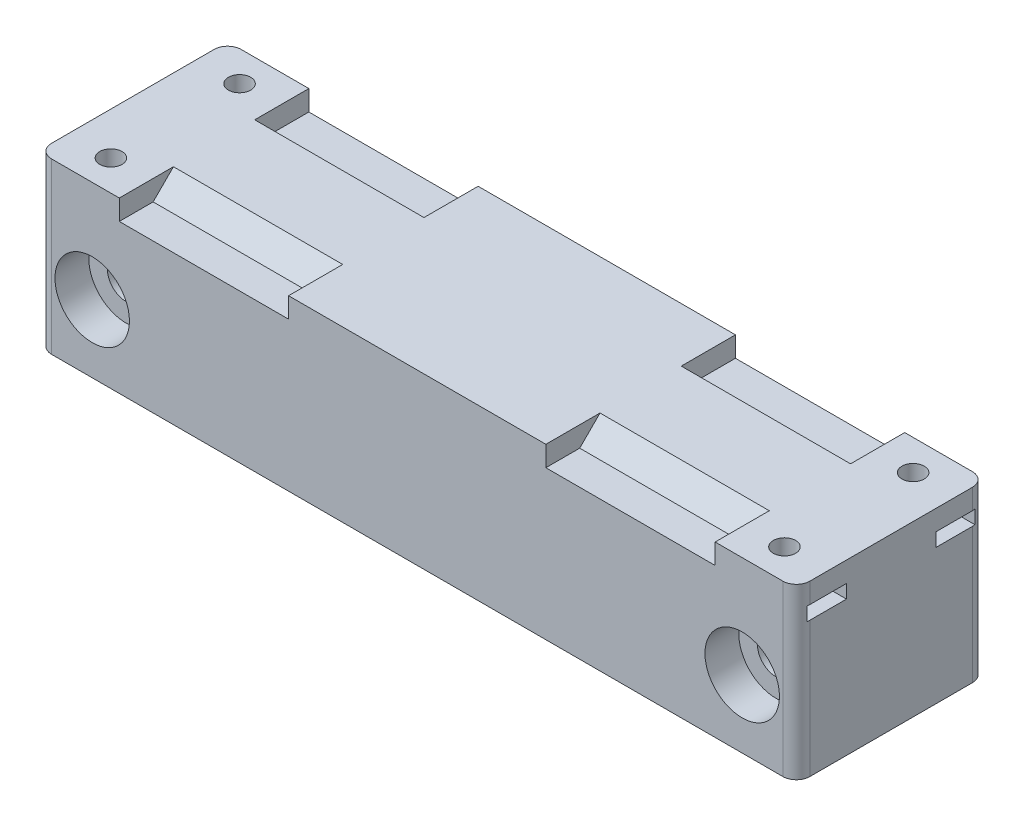
from build123d import *

# Parameters (mm, degrees)
SKETCH1_W                               = 56
SKETCH1_H                               = 25
BOSS_EXTRUDE1_DEPTH                     = 14
CBORE_FOR_M5_HEX_HEAD_BOLT1_D           = 5.5
CBORE_FOR_M5_HEX_HEAD_BOLT1_CBORE_D     = 11
CBORE_FOR_M5_HEX_HEAD_BOLT1_CBORE_DEPTH = 5
SKETCH9_W                               = 25
SKETCH9_H                               = 8
CUT_EXTRUDE2_DEPTH                      = 3
SKETCH8_W                               = 5.8
SKETCH8_H                               = 2
CUT_EXTRUDE1_DEPTH                      = 10
F_3_0MM_DOWEL_HOLE1_D                   = 3.3
F_3_0MM_DOWEL_HOLE1_DEPTH               = 8
F_3_0MM_DOWEL_HOLE1_TIP                 = 0.991420021
FILLET1_R                               = 2
CHAMFER2_SIZE                           = 3


# Some blends are built 0.0001 mm under size
with BuildPart() as part:
    # Sketch1 → Boss-Extrude1 (new, symmetric)
    with BuildSketch(Plane.XY):
        with Locations((-28, 12.5)):
            Rectangle(SKETCH1_W, SKETCH1_H)
    extrude(amount=BOSS_EXTRUDE1_DEPTH, both=True)

    # CBORE for M5 Hex Head Bolt1 (through all)
    with Locations(Plane.XY.offset(14)):
        with Locations((-48, 10)):
            CounterBoreHole(CBORE_FOR_M5_HEX_HEAD_BOLT1_D / 2, CBORE_FOR_M5_HEX_HEAD_BOLT1_CBORE_D / 2, CBORE_FOR_M5_HEX_HEAD_BOLT1_CBORE_DEPTH)

    # Sketch9 → Cut-Extrude2 (cut)
    with BuildSketch(Plane(origin=(0, 25, 0), x_dir=(1, 0, 0), z_dir=(0, 1, 0))):
        with Locations((-31.5, 10)):
            Rectangle(SKETCH9_W, SKETCH9_H)
        with Locations((-31.5, -10)):
            Rectangle(SKETCH9_W, SKETCH9_H)
    extrude(amount=-CUT_EXTRUDE2_DEPTH, mode=Mode.SUBTRACT)

    # Sketch8 → Cut-Extrude1 (cut)
    with BuildSketch(Plane.ZY.offset(56)):
        with Locations((-9.5, 21)):
            Rectangle(SKETCH8_W, SKETCH8_H)
        with Locations((9.5, 21)):
            Rectangle(SKETCH8_W, SKETCH8_H)
    extrude(amount=-CUT_EXTRUDE1_DEPTH, mode=Mode.SUBTRACT)

    # Mirror1: part across plane


with BuildPart() as part_1:
    add(part.part)
    add(part.part.mirror(Plane(origin=(0, 25, 14), x_dir=(0, 0, 1), z_dir=(-1, 0, 0))))

    # Ø3.0mm Dowel Hole1
    with Locations(Plane(origin=(0, 25, 0), x_dir=(1, 0, 0), z_dir=(0, 1, 0))):
        with Locations((49.74, 9.5), (-49.74, -9.5), (-49.74, 9.5), (49.74, -9.5)):
            Hole(F_3_0MM_DOWEL_HOLE1_D / 2, depth=F_3_0MM_DOWEL_HOLE1_DEPTH)
            with Locations((0, 0, -(F_3_0MM_DOWEL_HOLE1_DEPTH + F_3_0MM_DOWEL_HOLE1_TIP / 2))):  # 118° drill point
                Cone(0, F_3_0MM_DOWEL_HOLE1_D / 2, F_3_0MM_DOWEL_HOLE1_TIP, mode=Mode.SUBTRACT)

    # Fillet1
    # the kernel refuses this fillet: 2 mm, written as the material it takes off along each edge
    with BuildSketch(Plane(origin=(-56, 30, -14), x_dir=(0, 0, 1), z_dir=(0, -1, 0)), Plane(origin=(56, 30, -14), x_dir=(-1, 0, 0), z_dir=(0, -1, 0))) as fillet1_piece_1:
        with BuildLine():
            CenterArc((FILLET1_R, -FILLET1_R), FILLET1_R, 90, 90)
            Line((0, -FILLET1_R), (0, 0))
            Line((0, 0), (FILLET1_R, 0))
        make_face()
    extrude(amount=35, mode=Mode.SUBTRACT)
    with BuildSketch(Plane(origin=(-56, 30, 14), x_dir=(0, 0, -1), z_dir=(0, -1, 0)), Plane(origin=(56, 30, 14), x_dir=(-1, 0, 0), z_dir=(0, -1, 0))) as fillet1_piece_2:
        with BuildLine():
            CenterArc((FILLET1_R, FILLET1_R), FILLET1_R, 180, 90)
            Line((0, FILLET1_R), (0, 0))
            Line((0, 0), (FILLET1_R, 0))
        make_face()
    extrude(amount=35, mode=Mode.SUBTRACT)

    # Chamfer2
    chamfer2_edges = [part_1.edges().sort_by_distance(p)[0] for p in [
        (-31.5, 22, 6),
        (31.5, 22, 6),
        (-31.5, 22, -6),
        (31.5, 22, -6),
    ]]
    chamfer(chamfer2_edges, length=CHAMFER2_SIZE - 0.0001)  # a hair under: the kernel refuses the full size


solid = part_1.part
